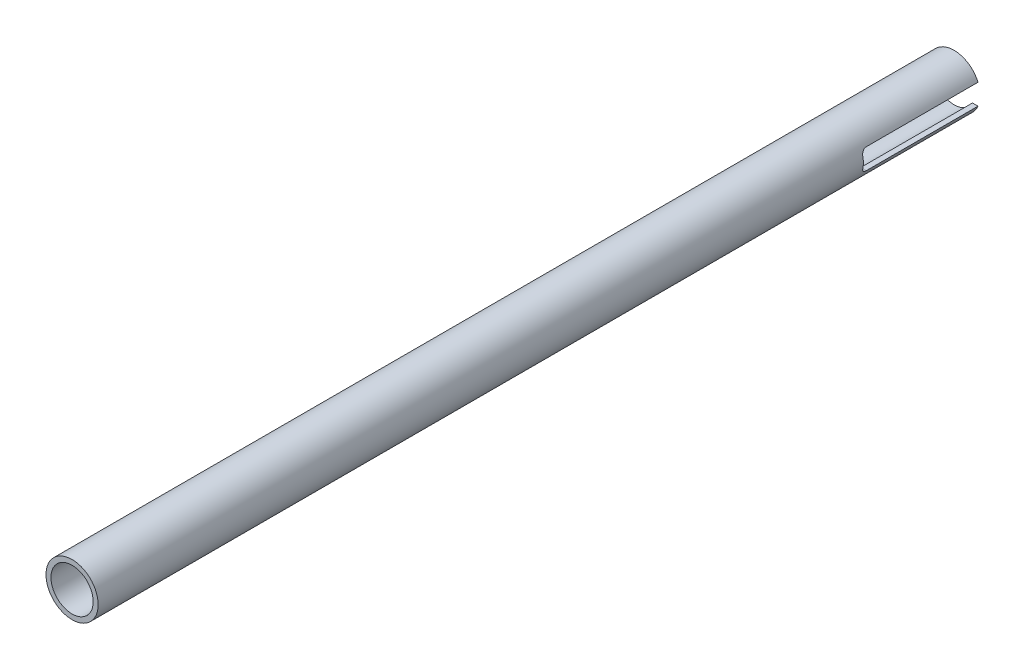
from build123d import *

# Parameters (mm, degrees)
SKETCH1_R               = 8.001
SKETCH1_R_2             = 6.477
BOSS_EXTRUDE1_DEPTH     = 270.51
CUT_EXTRUDE1_DEPTH      = 271.746545873
CUT_EXTRUDE1_DEPTH_BACK = 271.746545873


with BuildPart() as part:
    # Sketch1 → Boss-Extrude1 (new body)
    with BuildSketch(Plane.XY):
        Circle(SKETCH1_R)
        Circle(SKETCH1_R_2, mode=Mode.SUBTRACT)
    extrude(amount=BOSS_EXTRUDE1_DEPTH)

    # Sketch2 → Cut-Extrude1 (cut, two sides: drawn at the far end of the back side and taken through both)
    with BuildSketch(Plane(origin=(0, 0, 0), x_dir=(0, 0, -1), z_dir=(1, 0, 0)).offset(-CUT_EXTRUDE1_DEPTH_BACK)):
        with BuildLine():
            Line((551.481534592, 3.175), (0, 3.175))
            Line((0, 3.175), (-34.29, 3.175))
            ThreePointArc((-34.29, 3.175), (-35.367630735, 2.728630735), (-35.814, 1.651))
            Line((-35.814, 1.651), (-35.814, -1.651))
            ThreePointArc((-35.814, -1.651), (-35.367630735, -2.728630735), (-34.29, -3.175))
            Line((-34.29, -3.175), (0, -3.175))
            Line((0, -3.175), (551.481534592, -3.175))
            Line((551.481534592, -3.175), (1654.444603776, -3.175))
            Line((1654.444603776, -3.175), (1654.444603776, 3.175))
            Line((1654.444603776, 3.175), (551.481534592, 3.175))
        make_face()
    extrude(amount=CUT_EXTRUDE1_DEPTH + CUT_EXTRUDE1_DEPTH_BACK, mode=Mode.SUBTRACT)


solid = part.part
